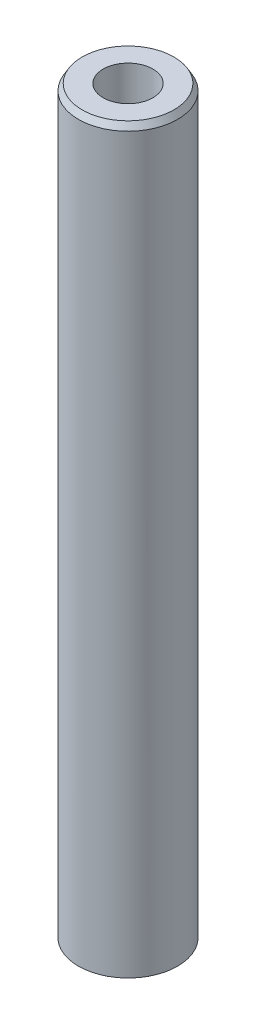
from build123d import *
from OCP.BRepFilletAPI import BRepFilletAPI_MakeChamfer

# Parameters (mm, degrees)
SKETCH1_R           = 40
BOSS_EXTRUDE1_DEPTH = 600
SKETCH2_R           = 20.090346949
CUT_EXTRUDE1_DEPTH  = 603.660766933
CHAMFER1_SIZE       = 5.163484241
CHAMFER1_SIZE2      = 2.981139016


with BuildPart() as part:
    # Sketch1 → Boss-Extrude1 (new body)
    with BuildSketch(Plane(origin=(0, 0, 0), x_dir=(1, 0, 0), z_dir=(0, 1, 0))):
        Circle(SKETCH1_R)
    extrude(amount=BOSS_EXTRUDE1_DEPTH)

    # Sketch2 → Cut-Extrude1 (cut, through all)
    with BuildSketch(Plane(origin=(0, 0, 0), x_dir=(1, 0, 0), z_dir=(0, 1, 0))):
        Circle(SKETCH2_R)
    extrude(amount=CUT_EXTRUDE1_DEPTH, mode=Mode.SUBTRACT)

    # Chamfer1: one chamfer whose edges measure the first distance from different faces: ONE call of the kernel's chamfer builder (chamfer() names one face for all edges)
    chamfer1_edges_1 = [part.edges().sort_by_distance(p)[0] for p in [
        (-40, 600, 0),
    ]]
    chamfer1_side_1 = [part.faces().sort_by_distance(p)[0] for p in [
        (-40, 300, 0),
    ]]
    chamfer1_edges_2 = [part.edges().sort_by_distance(p)[0] for p in [
        (-40, 0, 0),
    ]]
    chamfer1_side_2 = [part.faces().sort_by_distance(p)[0] for p in [
        (-38.86862915, 0, 0),
    ]]
    chamfer1 = BRepFilletAPI_MakeChamfer(part.part.solid().wrapped)
    for e in chamfer1_edges_1:
        chamfer1.Add(CHAMFER1_SIZE, CHAMFER1_SIZE2, e.wrapped, chamfer1_side_1[0].wrapped)  # the first distance lies on this face
    for e in chamfer1_edges_2:
        chamfer1.Add(CHAMFER1_SIZE, CHAMFER1_SIZE2, e.wrapped, chamfer1_side_2[0].wrapped)  # the first distance lies on this face
    add(Compound.cast(chamfer1.Shape()), mode=Mode.REPLACE)


solid = part.part
